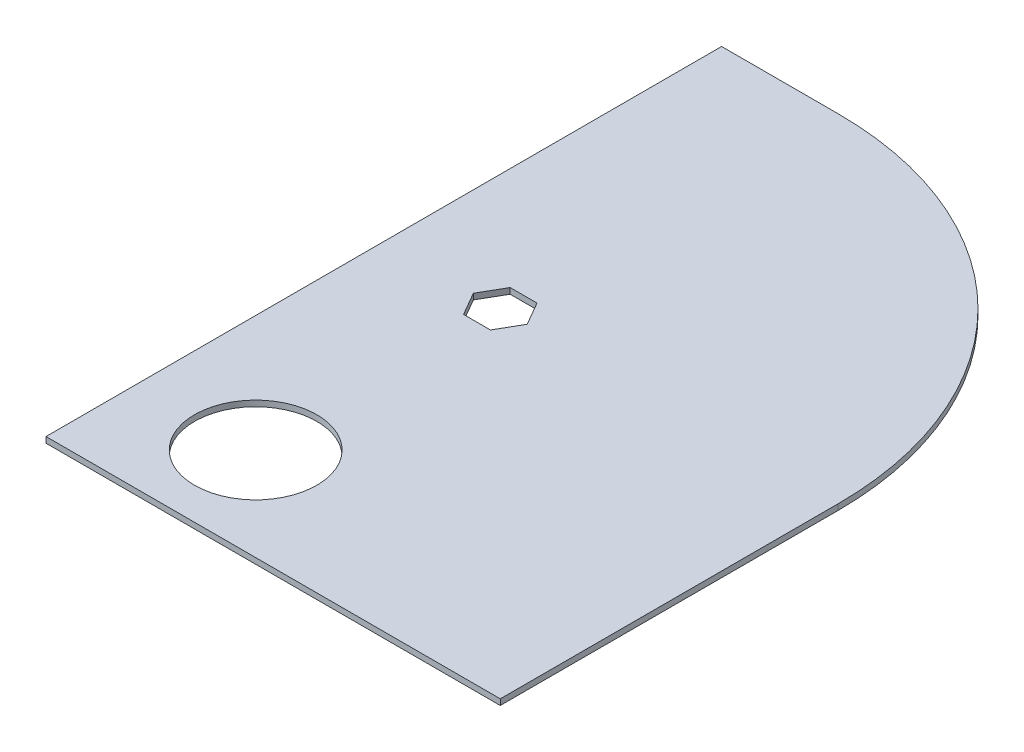
from build123d import *

# Parameters (mm, degrees)
BOSS_EXTRUDE2_DEPTH = 2.5
SKETCH3_R           = 26.25
CUT_EXTRUDE3_DEPTH  = 325.239494818
CUT_EXTRUDE5_DEPTH  = 325.239494818


with BuildPart() as part:
    # Sketch1 → Boss-Extrude2 (new body)
    with BuildSketch(Plane(origin=(0, 0, 0), x_dir=(1, 0, 0), z_dir=(0, 1, 0))):
        with BuildLine():
            Line((0, 0), (-50, 0))
            Line((-50, 0), (-50, 290))
            Line((-50, 290), (0, 290))
            ThreePointArc((0, 290), (102.530483272, 247.530483272), (145, 145))
            Line((145, 145), (145, 0))
            Line((145, 0), (0, 0))
        make_face()
    extrude(amount=BOSS_EXTRUDE2_DEPTH)

    # Sketch3 → Cut-Extrude3 (cut, through all)
    with BuildSketch(Plane(origin=(0, 0, 0), x_dir=(1, 0, 0), z_dir=(0, 1, 0))):
        with Locations((0, 40)):
            Circle(SKETCH3_R)
    extrude(amount=CUT_EXTRUDE3_DEPTH, mode=Mode.SUBTRACT)

    # Sketch6 → Cut-Extrude5 (cut, through all)
    with BuildSketch(Plane(origin=(0, 0, 0), x_dir=(1, 0, 0), z_dir=(0, 1, 0))):
        Polygon((5.773502692, 135), (11.547005384, 145), (5.773502692, 155), (-5.773502692, 155), (-11.547005384, 145), (-5.773502692, 135), align=None)
    extrude(amount=CUT_EXTRUDE5_DEPTH, mode=Mode.SUBTRACT)


solid = part.part
